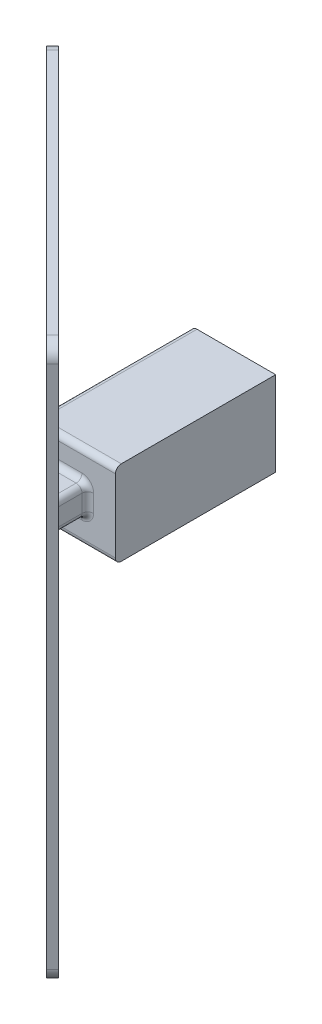
from build123d import *

# Parameters (mm, degrees)
SKETCH_1_W          = 29
SKETCH_1_H          = 29
SKETCH_1_W_2        = 19
SKETCH_1_H_2        = 19
EXTRUDE_1_DEPTH     = 50
SKETCH_2_W          = 29
SKETCH_2_H          = 29
EXTRUDE_2_DEPTH     = 5
SKETCH_3_W          = 10
SKETCH_3_H          = 10
EXTRUDE_3_DEPTH     = 10
CUT_EXTRUDE_1_DEPTH = 10
SKETCH_7_W          = 130
SKETCH_7_H          = 190
EXTRUDE_4_DEPTH     = 3
CUT_EXTRUDE_2_DEPTH = 165.058536671
SKETCH_10_R         = 1.25
CUT_EXTRUDE_3_DEPTH = 149.400384885
CUT_EXTRUDE_9_DEPTH = 3
FILLET_1_R          = 2
FILLET_3_R          = 5


with BuildPart() as part:
    # 草图1 → 凸台-拉伸1 (new body)
    with BuildSketch(Plane.XY):
        Rectangle(SKETCH_1_W, SKETCH_1_H)
        Rectangle(SKETCH_1_W_2, SKETCH_1_H_2, mode=Mode.SUBTRACT)
    extrude(amount=EXTRUDE_1_DEPTH)

    # 草图2 → 凸台-拉伸2 (add)
    with BuildSketch(Plane.XY.offset(50)):
        Rectangle(SKETCH_2_W, SKETCH_2_H)
    extrude(amount=EXTRUDE_2_DEPTH)

    # 草图3 → 凸台-拉伸3 (add)
    with BuildSketch(Plane.XY.offset(55)):
        Rectangle(SKETCH_3_W, SKETCH_3_H)
    extrude(amount=EXTRUDE_3_DEPTH)

    # 草图4 → 切除-拉伸1 (cut)
    with BuildSketch(Plane(origin=(0, 5, 0), x_dir=(1, 0, 0), z_dir=(0, 1, 0))):
        Polygon((-5, -55), (5, -65), (-5, -65), align=None)
    extrude(amount=-CUT_EXTRUDE_1_DEPTH, mode=Mode.SUBTRACT)

    # 草图7 → 凸台-拉伸4 (add)
    with BuildSketch(Plane(origin=(-30, 0, 30), x_dir=(0.7071067811865475, 0, 0.7071067811865476), z_dir=(-0.7071067811865476, 0, 0.7071067811865475))):
        with Locations((47.497474683, 0)):
            Rectangle(SKETCH_7_W, SKETCH_7_H)
    extrude(amount=EXTRUDE_4_DEPTH)

    # 草图8 → 切除-拉伸2 (cut, through all)
    with BuildSketch(Plane.XZ.offset(14.5)):
        Polygon((-14.5, 55), (-14.5, 49.742640687), (-9.242640687, 55), align=None)
    extrude(amount=-CUT_EXTRUDE_2_DEPTH, mode=Mode.SUBTRACT)

    # 草图10 → 切除-拉伸3 (cut, through all)
    with BuildSketch(Plane(origin=(-32.121320344, 0, 32.121320344), x_dir=(0.7071067811865475, 0, 0.7071067811865476), z_dir=(-0.7071067811865476, 0, 0.7071067811865475))):
        with Locations((107.497474683, 90)):
            Circle(SKETCH_10_R)
        with Locations((-12.502525317, 90)):
            Circle(SKETCH_10_R)
        with Locations((-12.502525317, -91)):
            Circle(SKETCH_10_R)
        with Locations((107.497474683, -90)):
            Circle(SKETCH_10_R)
    extrude(amount=-CUT_EXTRUDE_3_DEPTH, mode=Mode.SUBTRACT)

    # 草图11 → 切除-拉伸9 (cut)
    with BuildSketch(Plane(origin=(-32.121320344, 0, 32.121320344), x_dir=(0.7071067811865475, 0, 0.7071067811865476), z_dir=(-0.7071067811865476, 0, 0.7071067811865475))):
        Polygon((-0.25988463, -82), (95.254833996, -82), (91.254833996, -78), (3.74011537, -78), align=None)
        Polygon((99.497474683, -77.757359313), (99.497474683, 77.757359313), (95.497474683, 73.757359313), (95.497474683, -73.757359313), align=None)
        Polygon((-0.502525317, 73.757359313), (-4.502525317, 77.757359313), (-4.502525317, -77.757359313), (-0.502525317, -73.757359313), align=None)
        Polygon((91.254833996, 78), (95.254833996, 82), (-0.25988463, 82), (3.74011537, 78), align=None)
    extrude(amount=-CUT_EXTRUDE_9_DEPTH, mode=Mode.SUBTRACT)

    # 圆角1
    fillet_1_edges = [part.edges().sort_by_distance(p)[0] for p in [
        (5, 0, 55),
        (0, 5, 55),
        (5, 5, 60),
        (5, -5, 60),
        (0, -5, 55),
        (4.75, -14.5, 55),
        (-14.5, -14.5, 22.75),
        (-14.5, 14.5, 22.75),
        (4.75, 14.5, 55),
        (-28.415999231, 78, 33.705321112),
        (-31.244426356, 82, 30.876893988),
        (36.294678888, 82, 98.415999231),
        (33.466251763, 78, 95.587572106),
        (-31.415999231, -73.757359313, 30.705321112),
        (-34.244426356, -77.757359313, 27.876893988),
        (-34.244426356, 77.757359313, 27.876893988),
        (-31.415999231, 73.757359313, 30.705321112),
        (36.466251763, 73.757359313, 98.587572106),
        (39.294678888, 77.757359313, 101.415999231),
        (39.294678888, -77.757359313, 101.415999231),
        (36.466251763, -73.757359313, 98.587572106),
        (33.466251763, -78, 95.587572106),
        (-31.244426356, -82, 30.876893988),
        (-28.415999231, -78, 33.705321112),
        (36.294678888, -82, 98.415999231),
    ]]
    fillet(fillet_1_edges, radius=FILLET_1_R - 0.0001)  # a hair under: the kernel refuses the full size

    # 圆角3
    fillet_3_edges = [part.edges().sort_by_distance(p)[0] for p in [
        (-43.436814511, 95, 18.684505832),
        (-43.436814511, -95, 18.684505832),
        (48.487067043, -95, 110.608387387),
        (48.487067043, 95, 110.608387387),
    ]]
    fillet(fillet_3_edges, radius=FILLET_3_R)


solid = part.part
